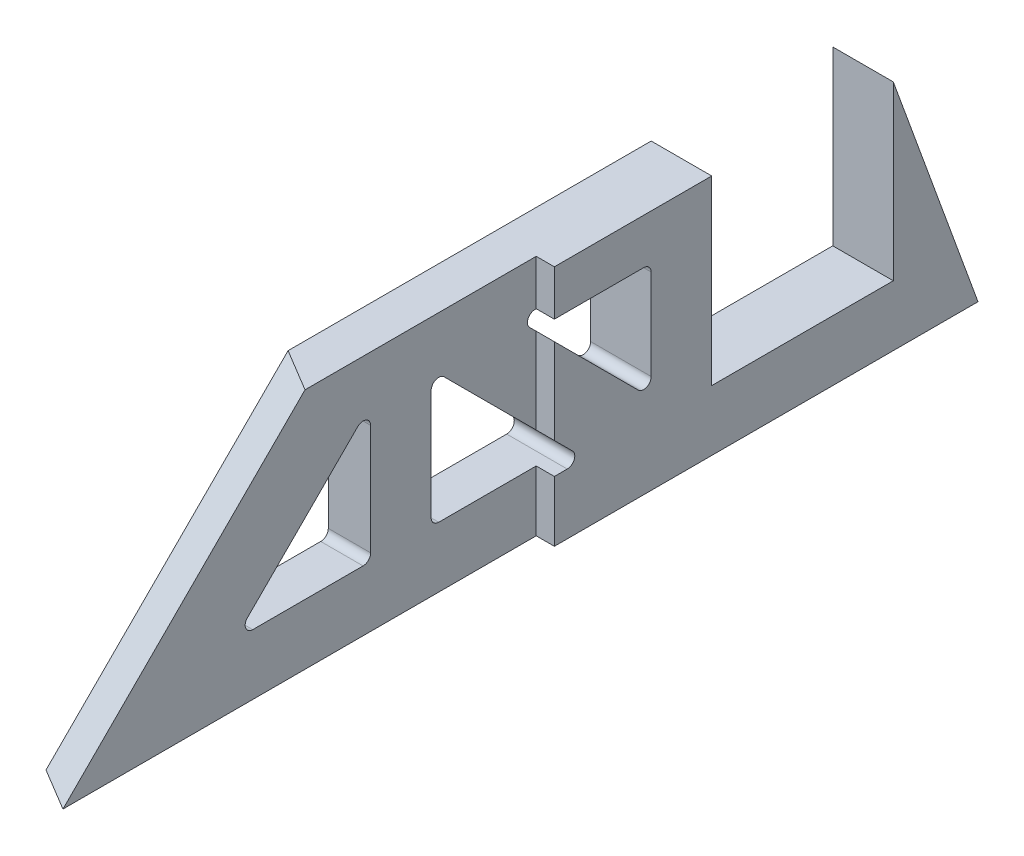
from build123d import *

# Parameters (mm, degrees)
BOSS_EXTRUDE1_DEPTH    = 12.7
CUT_EXTRUDE1_START     = -62.002468855
CUT_EXTRUDE1_OUTLINE_W = 16
CUT_EXTRUDE1_OUTLINE_H = 80
CUT_EXTRUDE1_DEPTH     = 4.960197509
CUT_EXTRUDE2_START     = 12.7
CUT_EXTRUDE2_DEPTH     = 3.81
CUT_EXTRUDE3_REACH     = 110.694
FILLET1_R              = 1.5875


# Read off the part's stored shape, not the designer's step: Cut-Extrude1
with BuildPart() as part:
    # Sketch1 → Boss-Extrude1 (new body)
    with BuildSketch(Plane(origin=(0, 0, 0), x_dir=(0, 0, -1), z_dir=(1, 0, 0))):
        Polygon((-44.45, 50.8), (-95.25, 0), (95.25, 0), (77.47, 48.850148518), (77.47, 12.7), (39.37, 12.7), (39.37, 50.8), align=None)
    extrude(amount=BOSS_EXTRUDE1_DEPTH)

    # Cut-Extrude1 outline → Cut-Extrude1 (cut)
    with BuildSketch(Plane(origin=(0, 0, 0), x_dir=(0.920574617898324, 0.27617238536949745, 0.27617238536949446), z_dir=(0.39056673294247013, -0.6509445549041233, -0.6509445549041163)).offset(CUT_EXTRUDE1_START)):
        with Locations((31, 29)):
            Rectangle(CUT_EXTRUDE1_OUTLINE_W, CUT_EXTRUDE1_OUTLINE_H)
    extrude(amount=CUT_EXTRUDE1_DEPTH, mode=Mode.SUBTRACT)

    # Sketch1<4> → Cut-Extrude2 (cut)
    with BuildSketch(Plane(origin=(0, 0, 0), x_dir=(0, 0, -1), z_dir=(1, 0, 0)).offset(CUT_EXTRUDE2_START)):
        Polygon((-44.45, 50.8), (-95.25, 0), (6.35, 0), (6.35, 50.8), align=None)
    extrude(amount=-CUT_EXTRUDE2_DEPTH, mode=Mode.SUBTRACT)

    # Sketch3 → Cut-Extrude3 (cut, up to next)
    with BuildSketch(Plane.ZY, mode=Mode.PRIVATE) as cut_extrude3_sk1:
        Polygon((56.969487758, 12.7), (28.394487758, 41.275), (28.394487758, 12.7), align=None)
    cut_extrude3_tool1 = extrude(cut_extrude3_sk1.sketch, amount=-CUT_EXTRUDE3_REACH, mode=Mode.PRIVATE) & part.part
    # Sketch3 → Cut-Extrude3 (cut, up to next)
    with BuildSketch(Plane.ZY, mode=Mode.PRIVATE) as cut_extrude3_sk2:
        Polygon((15.694487758, 41.275), (15.694487758, 12.7), (-12.880512242, 12.7), align=None)
    cut_extrude3_tool2 = extrude(cut_extrude3_sk2.sketch, amount=-CUT_EXTRUDE3_REACH, mode=Mode.PRIVATE) & part.part
    # Sketch3 → Cut-Extrude3 (cut, up to next)
    with BuildSketch(Plane.ZY, mode=Mode.PRIVATE) as cut_extrude3_sk3:
        Polygon((-2.266024484, 41.275), (-26.67, 16.871024484), (-26.67, 41.275), align=None)
    cut_extrude3_tool3 = extrude(cut_extrude3_sk3.sketch, amount=-CUT_EXTRUDE3_REACH, mode=Mode.PRIVATE) & part.part
    add(cut_extrude3_tool1.solids().sort_by_distance((0, 22.225, 37.919488))[0], mode=Mode.SUBTRACT)
    add(cut_extrude3_tool2.solids().sort_by_distance((0, 22.225, 6.169488))[0], mode=Mode.SUBTRACT)
    add(cut_extrude3_tool3.solids().sort_by_distance((0, 33.140341, -18.535341))[0], mode=Mode.SUBTRACT)

    # Fillet1
    fillet1_edges = [part.edges().sort_by_distance(p)[0] for p in [
        (4.445, 12.7, 56.969487758),
        (4.445, 12.7, 28.394487758),
        (4.445, 41.275, 28.394487758),
        (6.35, 41.275, -26.67),
        (4.445, 41.275, -2.266024484),
        (6.35, 16.871024484, -26.67),
        (4.445, 41.275, 15.694487758),
        (6.35, 12.7, -12.880512242),
        (4.445, 12.7, 15.694487758),
    ]]
    fillet(fillet1_edges, radius=FILLET1_R)


solid = part.part
